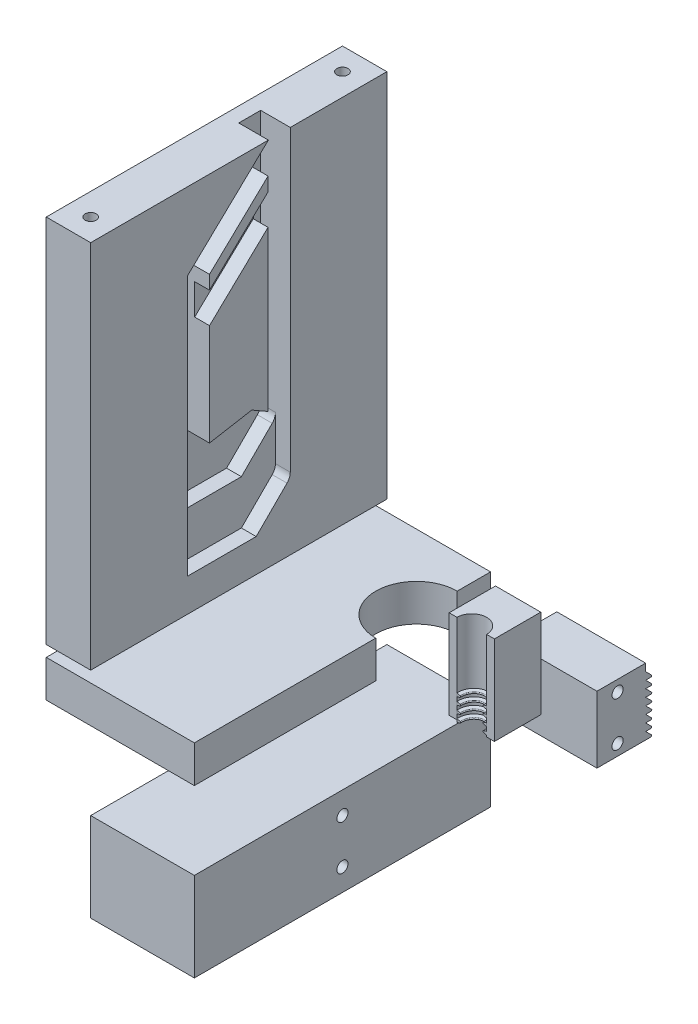
from build123d import *

# Parameters (mm, degrees)
SKETCH1_W               = 12
SKETCH1_H               = 80
SKETCH1_R               = 1.5
BOSS_EXTRUDE1_DEPTH     = 7
BOSS_EXTRUDE2_START     = -3
SKETCH1_3_W             = 12
SKETCH1_3_H             = 80
SKETCH1_3_R             = 1.5
BOSS_EXTRUDE2_DEPTH     = 3
BOSS_EXTRUDE3_START     = 10
SKETCH1_5_W             = 12
SKETCH1_5_H             = 80
SKETCH1_5_R             = 1.5
BOSS_EXTRUDE3_DEPTH     = 100
CUT_EXTRUDE1_DEPTH      = 4
LPATTERN1_START         = -56.886793137
LPATTERN1_DEPTH         = 8
BOSS_EXTRUDE4_START     = -48
SKETCH1_6_W             = 28
SKETCH1_6_H             = 80
BOSS_EXTRUDE4_DEPTH     = 24
CUT_EXTRUDE2_DEPTH      = 155.525548145
CUT_EXTRUDE2_DEPTH_BACK = 155.525548145
SKETCH4_R               = 1.5
SWEEP5_PITCH            = 2
SKETCH16_R              = 1.5
BOSS_EXTRUDE5_DEPTH     = 24
LPATTERN2_COUNT         = 4
LPATTERN2_PITCH         = 2
BOSS_EXTRUDE7_DEPTH     = 24


with BuildPart() as part:
    # Sketch1 → Boss-Extrude1 (new body)
    # profile 1 of 2: a face of its own
    with BuildSketch(Plane(origin=(0, 0, 0), x_dir=(1, 0, 0), z_dir=(0, 1, 0))):
        with BuildLine():
            Line((-20.886793137, 33.845423594), (-48.886793137, 33.845423594))
            Line((-48.886793137, 33.845423594), (-48.886793137, -46.154576406))
            Line((-48.886793137, -46.154576406), (-20.886793137, -46.154576406))
            Line((-20.886793137, -46.154576406), (-20.886793137, 2.845423594))
            ThreePointArc((-20.886793137, 2.845423594), (-31.886793137, 13.845423594), (-20.886793137, 24.845423594))
            Line((-20.886793137, 24.845423594), (-20.886793137, 33.845423594))
        make_face()
    # profile 2 of 2: a face of its own
    with BuildSketch(Plane(origin=(0, 0, 0), x_dir=(1, 0, 0), z_dir=(0, 1, 0))):
        with Locations((-54.886793137, -6.154576406)):
            Rectangle(SKETCH1_W, SKETCH1_H)
        with Locations(Location((-54.886793137, -40.154576406, 0), (0, 0, 270))):
            Circle(SKETCH1_R, mode=Mode.SUBTRACT)
        with Locations(Location((-54.886793137, 27.845423594, 0), (0, 0, 270))):
            Circle(SKETCH1_R, mode=Mode.SUBTRACT)
    extrude(amount=BOSS_EXTRUDE1_DEPTH)

    # Sketch1<3> → Boss-Extrude2 (add)
    # profile 1 of 2: a face of its own
    with BuildSketch(Plane(origin=(0, 0, 0), x_dir=(1, 0, 0), z_dir=(0, 1, 0)).offset(BOSS_EXTRUDE2_START)):
        with Locations((-54.886793137, -6.154576406)):
            Rectangle(SKETCH1_3_W, SKETCH1_3_H)
        with Locations(Location((-54.886793137, -40.154576406, 0), (0, 0, 270))):
            Circle(SKETCH1_3_R, mode=Mode.SUBTRACT)
        with Locations(Location((-54.886793137, 27.845423594, 0), (0, 0, 270))):
            Circle(SKETCH1_3_R, mode=Mode.SUBTRACT)
    # profile 2 of 2: a face of its own
    with BuildSketch(Plane(origin=(0, 0, 0), x_dir=(1, 0, 0), z_dir=(0, 1, 0)).offset(BOSS_EXTRUDE2_START)):
        with BuildLine():
            Line((-20.886793137, 33.845423594), (-48.886793137, 33.845423594))
            Line((-48.886793137, 33.845423594), (-48.886793137, -46.154576406))
            Line((-48.886793137, -46.154576406), (-20.886793137, -46.154576406))
            Line((-20.886793137, -46.154576406), (-20.886793137, 2.845423594))
            ThreePointArc((-20.886793137, 2.845423594), (-31.886793137, 13.845423594), (-20.886793137, 24.845423594))
            Line((-20.886793137, 24.845423594), (-20.886793137, 33.845423594))
        make_face()
    extrude(amount=BOSS_EXTRUDE2_DEPTH)


with BuildPart() as body_2:
    # Sketch1<5> → Boss-Extrude3 (new body)
    with BuildSketch(Plane(origin=(0, 0, 0), x_dir=(1, 0, 0), z_dir=(0, 1, 0)).offset(BOSS_EXTRUDE3_START)):
        with Locations((-54.886793137, -6.154576406)):
            Rectangle(SKETCH1_5_W, SKETCH1_5_H)
        with Locations(Location((-54.886793137, -40.154576406, 0), (0, 0, 270))):
            Circle(SKETCH1_5_R, mode=Mode.SUBTRACT)
        with Locations(Location((-54.886793137, 27.845423594, 0), (0, 0, 270))):
            Circle(SKETCH1_5_R, mode=Mode.SUBTRACT)
    extrude(amount=BOSS_EXTRUDE3_DEPTH)

    # Sketch3 → Cut-Extrude1 (cut)
    with BuildSketch(Plane(origin=(-48.886793137, 0, 0), x_dir=(0, 0, -1), z_dir=(1, 0, 0))):
        with BuildLine():
            Line((7.755299902, 29.35668778), (7.755299902, 103.642959472))
            Line((7.755299902, 103.642959472), (-20.064452715, 77.118196368))
            Line((-20.064452715, 77.118196368), (-20.064452715, 31.506125799))
            ThreePointArc((-20.064452715, 31.506125799), (-19.362586044, 33.434488628), (-17.585397248, 34.460549058))
            Line((-17.585397248, 34.460549058), (-14.064452715, 35.081386577))
            Line((-14.064452715, 35.081386577), (-14.064452715, 74.548758471))
            Line((-14.064452715, 74.548758471), (1.755299902, 89.63211296))
            Line((1.755299902, 89.63211296), (1.755299902, 34.552840203))
            Line((1.755299902, 34.552840203), (6.255299902, 31.954763992))
            ThreePointArc((6.255299902, 31.954763992), (7.353376114, 30.85668778), (7.755299902, 29.35668778))
        make_face()
        Polygon((1.755299902, 30.599328467), (1.755299902, 34.552840203), (-2.647109204, 37.094572286), (-14.064452715, 35.081386577), (-14.064452715, 31.506125799), (-14.064452715, 28.988826905), (-3.75586439, 30.80650916), (-0.130578937, 28.713449628), align=None)
        with BuildLine():
            Line((-1.449788847, 18.908958344), (6.876620246, 27.235367437))
            ThreePointArc((6.876620246, 27.235367437), (5.146878479, 26.382353196), (3.255299902, 26.758611569))
            Line((3.255299902, 26.758611569), (-0.130578937, 28.713449628))
            Line((-0.130578937, 28.713449628), (-3.935070221, 24.908958344))
            Line((-3.935070221, 24.908958344), (-14.064452715, 24.908958344))
            Line((-14.064452715, 24.908958344), (-14.064452715, 28.988826905))
            Line((-14.064452715, 28.988826905), (-16.543508182, 28.55170254))
            ThreePointArc((-16.543508182, 28.55170254), (-18.992815544, 29.20799247), (-20.064452715, 31.506125799))
            Line((-20.064452715, 31.506125799), (-20.064452715, 18.908958344))
            Line((-20.064452715, 18.908958344), (-1.449788847, 18.908958344))
        make_face()
        with BuildLine():
            ThreePointArc((-17.585397248, 34.460549058), (-19.362586044, 33.434488628), (-20.064452715, 31.506125799))
            ThreePointArc((-20.064452715, 31.506125799), (-18.992815544, 29.20799247), (-16.543508182, 28.55170254))
            ThreePointArc((-16.543508182, 28.55170254), (-14.766319385, 29.57776297), (-14.064452715, 31.506125799))
            ThreePointArc((-14.064452715, 31.506125799), (-15.136089886, 33.804259128), (-17.585397248, 34.460549058))
        make_face()
        with BuildLine():
            ThreePointArc((6.876620246, 27.235367437), (7.5269385, 28.208637483), (7.755299902, 29.35668778))
            ThreePointArc((7.755299902, 29.35668778), (7.353376114, 30.85668778), (6.255299902, 31.954763992))
            ThreePointArc((6.255299902, 31.954763992), (4.363721326, 32.331022364), (2.633979559, 31.478008124))
            Line((2.633979559, 31.478008124), (1.755299902, 30.599328467))
            Line((1.755299902, 30.599328467), (1.755299902, 29.35668778))
            ThreePointArc((1.755299902, 29.35668778), (2.157223691, 27.85668778), (3.255299902, 26.758611569))
            ThreePointArc((3.255299902, 26.758611569), (5.146878479, 26.382353196), (6.876620246, 27.235367437))
        make_face()
        with BuildLine():
            Line((-14.064452715, 35.081386577), (-17.585397248, 34.460549058))
            ThreePointArc((-17.585397248, 34.460549058), (-15.136089886, 33.804259128), (-14.064452715, 31.506125799))
            Line((-14.064452715, 31.506125799), (-14.064452715, 35.081386577))
        make_face()
        with BuildLine():
            ThreePointArc((-14.064452715, 31.506125799), (-14.766319385, 29.57776297), (-16.543508182, 28.55170254))
            Line((-16.543508182, 28.55170254), (-14.064452715, 28.988826905))
            Line((-14.064452715, 28.988826905), (-14.064452715, 31.506125799))
        make_face()
        with BuildLine():
            ThreePointArc((2.633979559, 31.478008124), (4.363721326, 32.331022364), (6.255299902, 31.954763992))
            Line((6.255299902, 31.954763992), (1.755299902, 34.552840203))
            Line((1.755299902, 34.552840203), (1.755299902, 30.599328467))
            Line((1.755299902, 30.599328467), (2.633979559, 31.478008124))
        make_face()
        with BuildLine():
            Line((-0.130578937, 28.713449628), (3.255299902, 26.758611569))
            ThreePointArc((3.255299902, 26.758611569), (2.157223691, 27.85668778), (1.755299902, 29.35668778))
            Line((1.755299902, 29.35668778), (1.755299902, 30.599328467))
            Line((1.755299902, 30.599328467), (-0.130578937, 28.713449628))
        make_face()
        Polygon((-3.935070221, 24.908958344), (-0.130578937, 28.713449628), (-3.75586439, 30.80650916), (-14.064452715, 28.988826905), (-14.064452715, 24.908958344), align=None)
    extrude(amount=-CUT_EXTRUDE1_DEPTH, mode=Mode.SUBTRACT)

    # LPattern1: read off the stored shape, not the designer's step
    # LPattern1 outline → LPattern1 (cut)
    with BuildSketch(Plane.YZ.offset(LPATTERN1_START)):
        with BuildLine():
            Line((110, -1.836840389), (89.118196368, 20.064452715))
            Line((89.118196368, 20.064452715), (30.908958344, 20.064452715))
            Line((30.908958344, 20.064452715), (30.908958344, 1.449788847))
            Line((30.908958344, 1.449788847), (39.235367437, -6.876620246))
            ThreePointArc((39.235367437, -6.876620246), (40.208637483, -7.5269385), (41.35668778, -7.755299902))
            Line((41.35668778, -7.755299902), (110, -7.755299902))
            Line((110, -7.755299902), (110, -1.836840389))
        make_face()
        Polygon((101.63211296, -1.755299902), (46.552840203, -1.755299902), (49.094572286, 2.647109204), (47.081386577, 14.064452715), (86.548758471, 14.064452715), align=None, mode=Mode.SUBTRACT)
    extrude(amount=LPATTERN1_DEPTH, mode=Mode.SUBTRACT)


with BuildPart() as body_3:
    # Sketch1<6> → Boss-Extrude4 (new body)
    with BuildSketch(Plane(origin=(0, 0, 0), x_dir=(1, 0, 0), z_dir=(0, 1, 0)).offset(BOSS_EXTRUDE4_START)):
        with Locations((-34.886793137, -6.154576406)):
            Rectangle(SKETCH1_6_W, SKETCH1_6_H)
    extrude(amount=BOSS_EXTRUDE4_DEPTH)

    # Sketch4 → Cut-Extrude2 (cut, two sides: drawn at the far end of the back side and taken through both)
    with BuildSketch(Plane(origin=(-20.886793137, 0, 67.041369543), x_dir=(0, 0, 1), z_dir=(-1, 0, 0)).offset(-CUT_EXTRUDE2_DEPTH_BACK)):
        with Locations(Location((-60.886793137, -30, 0), (0, 0, 180))):
            Circle(SKETCH4_R)
        with Locations(Location((-60.886793137, -42, 0), (0, 0, 180))):
            Circle(SKETCH4_R)
    extrude(amount=CUT_EXTRUDE2_DEPTH + CUT_EXTRUDE2_DEPTH_BACK, mode=Mode.SUBTRACT)


with BuildPart() as body_4:
    # Sweep5: arcs per turn and ends read off the stored shape
    # Sweep5: the profile of Sketch7 screwed along a left-hand helix through 0.5 turns, 10 arcs to a turn; built about Z, then put on its axis
    sweep5_z = Axis((0, 0, 0), (0, 0, 1))
    sweep5_corners = [(-3.153553391, 0, 0.066140078), (-4, 0, 0.292944764), (-4, 0, -0.560893956), (-3.153553391, 0, -0.334089271), (-3, 0, -0.133974596)]
    with BuildLine(mode=Mode.PRIVATE) as sweep5_profile:
        Line(sweep5_corners[0], sweep5_corners[1])
        Line(sweep5_corners[1], sweep5_corners[2])
        Line(sweep5_corners[2], sweep5_corners[3])
        ThreePointArc((-3.153553391, 0, -0.334089271), (-3.042811806, 0, -0.26009411), (-3, 0, -0.133974596))
        ThreePointArc((-3, 0, -0.133974596), (-3.042811806, 0, -0.007855083), (-3.153553391, 0, 0.066140078))
    sweep5_cap = Face(sweep5_profile.wire())
    sweep5_arcs = [((-3.153553391, 0, -0.334089271), (-3, 0, -0.292944764), (-3, 0, -0.133974596), (1, 0.7933533402912396, 1)), ((-3, 0, -0.133974596), (-3, 0, 0.024995571), (-3.153553391, 0, 0.066140078), (1, 0.7933533402912396, 1))]  # start, shoulder, end, weights
    sweep5_turn_angles = [0, -18, -36, -54, -72, -90, -108, -126, -144, -162, -180]
    sweep5_turn_weights = [1, 0.9510565162951535, 1, 0.9510565162951535, 1, 0.9510565162951535, 1, 0.9510565162951535, 1, 0.9510565162951525, 1]
    sweep5_turn_rails = [Edge.make_bspline([Vector(p[0], p[1], 0).rotate(sweep5_z, sweep5_turn_angles[k]) / sweep5_turn_weights[k] + Vector(0, 0, p[2] + -SWEEP5_PITCH * sweep5_turn_angles[k] / 360) for k in range(11)], [0, 0, 0, 1, 1, 2, 2, 3, 3, 4, 4, 5, 5, 5], 2, sweep5_turn_weights) for p in sweep5_corners]
    sweep5_turn_sides = [*[Face.make_surface_from_curves(sweep5_turn_rails[p[0]], sweep5_turn_rails[p[1]]) for p in [(0, 1), (1, 2), (2, 3)]], *[Face.make_bezier_surface([[Vector(p[j][0], p[j][1], 0).rotate(sweep5_z, sweep5_turn_angles[2 * i + k]) / sweep5_turn_weights[2 * i + k] + Vector(0, 0, p[j][2] + -SWEEP5_PITCH * sweep5_turn_angles[2 * i + k] / 360) for k in range(3)] for j in range(3)], [[p[3][j] * sweep5_turn_weights[2 * i + k] for k in range(3)] for j in range(3)]) for p in sweep5_arcs for i in range(5)]]
    sweep5 = Plane(origin=(-10.886793137, -17.090673096, -18.774031487), x_dir=(1, 0, 0), z_dir=(0, 1, 0)) * Solid(Shell([*sweep5_turn_sides, sweep5_cap, sweep5_cap.rotate(sweep5_z, -180).moved(Location((0, 0, -SWEEP5_PITCH * -180 / 360)))]))
    add(sweep5)

    # Sketch17 → Boss-Extrude7 (add)
    with BuildSketch(Plane(origin=(-10.886793137, -17.090673096, -18.774031487), x_dir=(1, 0, 0), z_dir=(0, 1, 0))):
        with BuildLine():
            Line((6.11385626, 12.524325841), (-6.11385626, 12.524325841))
            Line((-6.11385626, 12.524325841), (-6.11385626, 0))
            Line((-6.11385626, 0), (-4, 0))
            ThreePointArc((-4, 0), (0, 4), (4, 0))
            Line((4, 0), (6.11385626, 0))
            Line((6.11385626, 0), (6.11385626, 12.524325841))
        make_face()
    extrude(amount=BOSS_EXTRUDE7_DEPTH)


with BuildPart() as body_5:
    # Sketch16 → Boss-Extrude5 (new body)
    with BuildSketch(Plane(origin=(-20.886793137, 0, 0), x_dir=(0, 0, -1), z_dir=(1, 0, 0))):
        with BuildLine():
            Line((51.740708635, -27.287583964), (53.313931939, -28.860807269))
            ThreePointArc((53.313931939, -28.860807269), (53.368125127, -29.133254822), (53.137155244, -29.287583964))
            Line((53.137155244, -29.287583964), (51.740708635, -29.287583964))
            Line((51.740708635, -29.287583964), (38.5843843, -29.287583964))
            Line((38.5843843, -29.287583964), (38.5843843, -11.287583964))
            Line((38.5843843, -11.287583964), (51.740708635, -11.287583964))
            Line((51.740708635, -11.287583964), (51.740708635, -13.287583964))
            Line((51.740708635, -13.287583964), (53.313931939, -14.860807269))
            ThreePointArc((53.313931939, -14.860807269), (53.368125127, -15.133254822), (53.137155244, -15.287583964))
            Line((53.137155244, -15.287583964), (51.740708635, -15.287583964))
            Line((51.740708635, -15.287583964), (53.313931939, -16.860807269))
            ThreePointArc((53.313931939, -16.860807269), (53.368125127, -17.133254822), (53.137155244, -17.287583964))
            Line((53.137155244, -17.287583964), (51.740708635, -17.287583964))
            Line((51.740708635, -17.287583964), (53.313931939, -18.860807269))
            ThreePointArc((53.313931939, -18.860807269), (53.368125127, -19.133254822), (53.137155244, -19.287583964))
            Line((53.137155244, -19.287583964), (51.740708635, -19.287583964))
            Line((51.740708635, -19.287583964), (53.313931939, -20.860807269))
            ThreePointArc((53.313931939, -20.860807269), (53.368125127, -21.133254822), (53.137155244, -21.287583964))
            Line((53.137155244, -21.287583964), (51.740708635, -21.287583964))
            Line((51.740708635, -21.287583964), (53.313931939, -22.860807269))
            ThreePointArc((53.313931939, -22.860807269), (53.368125127, -23.133254822), (53.137155244, -23.287583964))
            Line((53.137155244, -23.287583964), (51.740708635, -23.287583964))
            Line((51.740708635, -23.287583964), (53.313931939, -24.860807269))
            ThreePointArc((53.313931939, -24.860807269), (53.368125127, -25.133254822), (53.137155244, -25.287583964))
            Line((53.137155244, -25.287583964), (51.740708635, -25.287583964))
            Line((51.740708635, -25.287583964), (53.313931939, -26.860807269))
            ThreePointArc((53.313931939, -26.860807269), (53.368125127, -27.133254822), (53.137155244, -27.287583964))
            Line((53.137155244, -27.287583964), (51.740708635, -27.287583964))
        make_face()
        with Locations((44.15813898, -26.287583964)):
            Circle(SKETCH16_R, mode=Mode.SUBTRACT)
        with Locations((44.15813898, -14.287583964)):
            Circle(SKETCH16_R, mode=Mode.SUBTRACT)
    extrude(amount=BOSS_EXTRUDE5_DEPTH)


with BuildPart() as lpattern2_1:
    # LPattern2: Sweep5 ×4
    with Locations(*[(0, i * LPATTERN2_PITCH, 0) for i in range(1, LPATTERN2_COUNT)]):
        add(sweep5)


solid = Compound([part.part, body_2.part, body_3.part, body_4.part, body_5.part, lpattern2_1.part])
